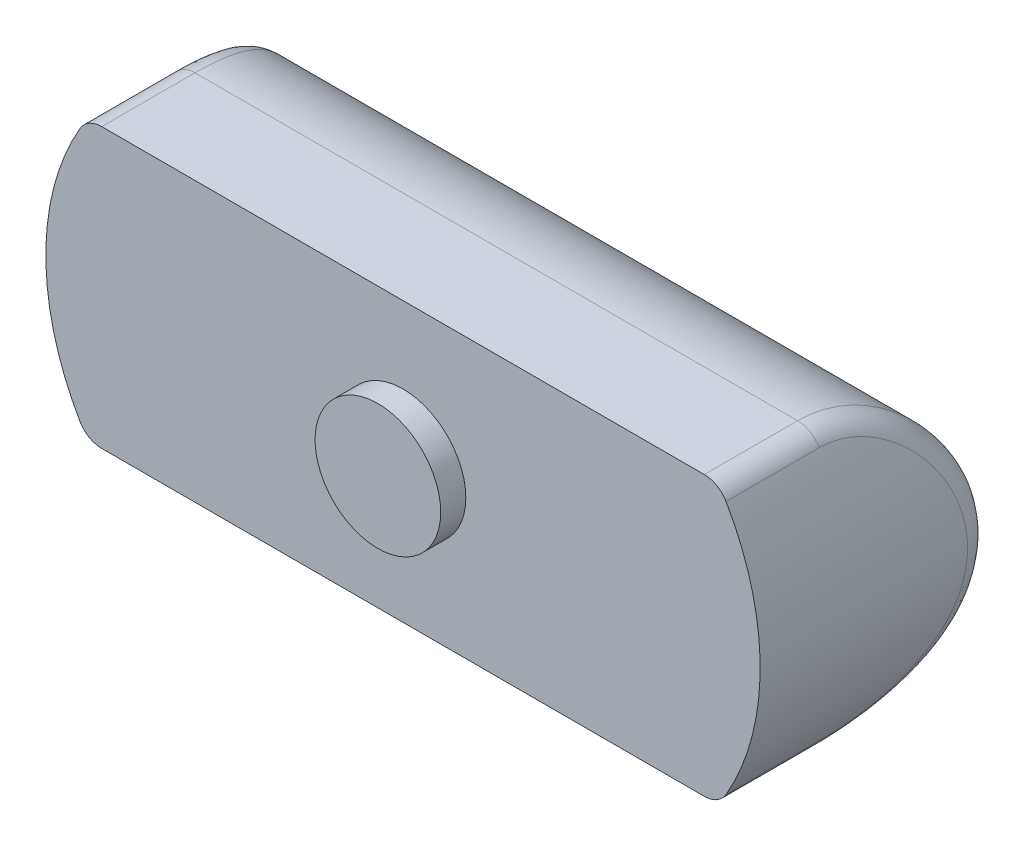
from build123d import *

# Parameters (mm, degrees)
BOSS_EXTRUDE1_DEPTH      = 27.77
FILLET1_START            = -44
FILLET1_DEPTH            = 88
FILLET2_R                = 3
SKETCH3_R                = 7.5
BOSS_EXTRUDE2_DEPTH      = 3
BOSS_EXTRUDE3_DEPTH      = 2
BOSS_EXTRUDE3_DEPTH_BACK = 3
SKETCH4_R                = 6.5


with BuildPart() as part:
    # Sketch2 → Boss-Extrude1 (new body)
    with BuildSketch(Plane.XY):
        with BuildLine():
            Line((-37.65, 16.64), (37.65, 16.64))
            ThreePointArc((37.65, 16.64), (42.65, 0), (37.65, -16.64))
            Line((37.65, -16.64), (-37.65, -16.64))
            ThreePointArc((-37.65, -16.64), (-42.65, 0), (-37.65, 16.64))
        make_face()
    extrude(amount=BOSS_EXTRUDE1_DEPTH)

    # Fillet1: read off the stored shape, not the designer's step
    # Fillet1 outline → Fillet1 (cut)
    with BuildSketch(Plane.YZ.offset(FILLET1_START)):
        with BuildLine():
            Line((16.64, 0), (16.64, 16.64))
            ThreePointArc((16.64, 16.64), (11.766256851, 4.873743173), (3.4e-08, 0))
            Line((3.4e-08, 0), (16.64, 0))
        make_face()
        with BuildLine():
            Line((-16.64, 0), (3.4e-08, 0))
            ThreePointArc((3.4e-08, 0), (-11.766256827, 4.873743149), (-16.64, 16.64))
            Line((-16.64, 16.64), (-16.64, 0))
        make_face()
    extrude(amount=FILLET1_DEPTH, mode=Mode.SUBTRACT)

    # Fillet2
    fillet2_edges = [part.edges().sort_by_distance(p)[0] for p in [
        (40.256336976, -11.781119236, 4.888624385),
        (-40.256337033, -11.781119103, 4.888624252),
        (-37.65, 16.64, 22.205),
        (37.65, 16.64, 22.205),
        (37.65, -16.64, 22.205),
        (-37.65, -16.64, 22.205),
    ]]
    fillet(fillet2_edges, radius=FILLET2_R)

    # Sketch3 → Boss-Extrude2 (add)
    with BuildSketch(Plane.XY.offset(27.77)):
        Circle(SKETCH3_R)
    extrude(amount=BOSS_EXTRUDE2_DEPTH)

    # Sketch4 → Boss-Extrude3 (add, two sides: drawn at the far end of the back side and taken through both)
    with BuildSketch(Plane.XZ.offset(16.64).offset(-BOSS_EXTRUDE3_DEPTH_BACK)):
        with Locations((0, 16.64)):
            Circle(SKETCH4_R)
    extrude(amount=BOSS_EXTRUDE3_DEPTH + BOSS_EXTRUDE3_DEPTH_BACK)


solid = part.part
